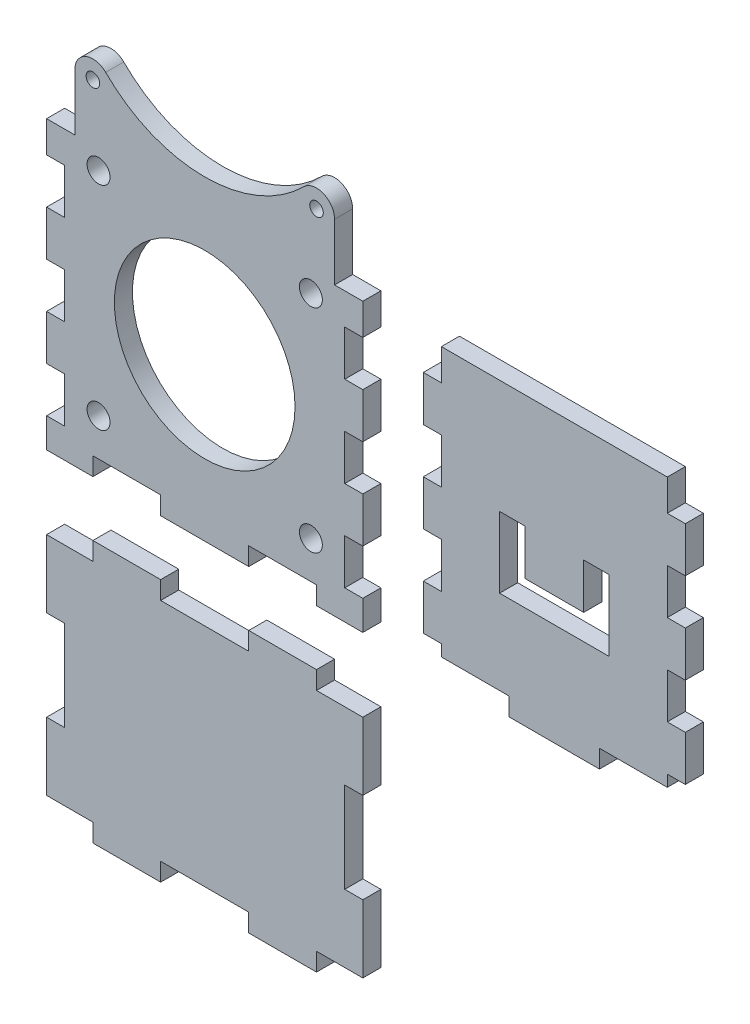
from build123d import *

# Parameters (mm, degrees)
SKETCH1_R             = 2.54
SKETCH1_R_2           = 20
SKETCH1_R_3           = 1.5
BOSS_EXTRUDE1_DEPTH   = 4
BOSS_EXTRUDE1_2_DEPTH = 4
BOSS_EXTRUDE1_3_DEPTH = 4


with BuildPart() as part:
    # Sketch1 → Boss-Extrude1 (new body)
    with BuildSketch(Plane.XY):
        with BuildLine():
            Line((-35, -94.278824944), (-35, -100.830704015))
            Line((-35, -100.830704015), (-24.748737342, -100.830704015))
            Line((-24.748737342, -100.830704015), (-24.748737342, -96.830704015))
            Line((-24.748737342, -96.830704015), (-9.748737342, -96.830704015))
            Line((-9.748737342, -96.830704015), (-9.748737342, -100.830704015))
            Line((-9.748737342, -100.830704015), (9.748737342, -100.830704015))
            Line((9.748737342, -100.830704015), (9.748737342, -96.830704015))
            Line((9.748737342, -96.830704015), (24.748737342, -96.830704015))
            Line((24.748737342, -96.830704015), (24.748737342, -100.830704015))
            Line((24.748737342, -100.830704015), (35, -100.830704015))
            Line((35, -100.830704015), (35, -94.278824944))
            Line((35, -94.278824944), (31, -94.278824944))
            Line((31, -94.278824944), (31, -84.278824944))
            Line((31, -84.278824944), (35, -84.278824944))
            Line((35, -84.278824944), (35, -74.278824944))
            Line((35, -74.278824944), (31, -74.278824944))
            Line((31, -74.278824944), (31, -64.278824944))
            Line((31, -64.278824944), (35, -64.278824944))
            Line((35, -64.278824944), (35, -54.278824944))
            Line((35, -54.278824944), (31, -54.278824944))
            Line((31, -54.278824944), (31, -44.278824944))
            Line((31, -44.278824944), (35, -44.278824944))
            Line((35, -44.278824944), (35, -37.330704015))
            Line((35, -37.330704015), (28.748737342, -37.330704015))
            Line((28.748737342, -37.330704015), (28.748737342, -24.748737342))
            ThreePointArc((28.748737342, -24.748737342), (26.279471071, -21.053219211), (21.920310217, -21.920310217))
            ThreePointArc((21.920310217, -21.920310217), (0, -31), (-21.920310217, -21.920310217))
            ThreePointArc((-21.920310217, -21.920310217), (-26.279471071, -21.053219211), (-28.748737342, -24.748737342))
            Line((-28.748737342, -24.748737342), (-28.748737342, -37.330704015))
            Line((-28.748737342, -37.330704015), (-35, -37.330704015))
            Line((-35, -37.330704015), (-35, -44.278824944))
            Line((-35, -44.278824944), (-31, -44.278824944))
            Line((-31, -44.278824944), (-31, -54.278824944))
            Line((-31, -54.278824944), (-35, -54.278824944))
            Line((-35, -54.278824944), (-35, -64.278824944))
            Line((-35, -64.278824944), (-31, -64.278824944))
            Line((-31, -64.278824944), (-31, -74.278824944))
            Line((-31, -74.278824944), (-35, -74.278824944))
            Line((-35, -74.278824944), (-35, -84.278824944))
            Line((-35, -84.278824944), (-31, -84.278824944))
            Line((-31, -84.278824944), (-31, -94.278824944))
            Line((-31, -94.278824944), (-35, -94.278824944))
        make_face()
        with Locations((-23.5, -88.549683874)):
            Circle(SKETCH1_R, mode=Mode.SUBTRACT)
        with Locations((0, -65.049683874)):
            Circle(SKETCH1_R_2, mode=Mode.SUBTRACT)
        with Locations((23.5, -88.549683874)):
            Circle(SKETCH1_R, mode=Mode.SUBTRACT)
        with Locations((-23.5, -41.549683874)):
            Circle(SKETCH1_R, mode=Mode.SUBTRACT)
        with Locations((-24.748737342, -24.748737342)):
            Circle(SKETCH1_R_3, mode=Mode.SUBTRACT)
        with Locations((23.5, -41.549683874)):
            Circle(SKETCH1_R, mode=Mode.SUBTRACT)
        with Locations((24.748737342, -24.748737342)):
            Circle(SKETCH1_R_3, mode=Mode.SUBTRACT)
    extrude(amount=BOSS_EXTRUDE1_DEPTH)


with BuildPart() as body_2:
    # Sketch1 → Boss-Extrude1 2 (new body)
    with BuildSketch(Plane.XY):
        Polygon((87.392932462, -100.830704015), (87.392932462, -96.830704015), (102.392932462, -96.830704015), (102.392932462, -94.278824944), (106.392932462, -94.278824944), (106.392932462, -84.278824944), (102.392932462, -84.278824944), (102.392932462, -74.278824944), (106.392932462, -74.278824944), (106.392932462, -64.278824944), (102.392932462, -64.278824944), (102.392932462, -54.278824944), (106.392932462, -54.278824944), (106.392932462, -44.278824944), (102.392932462, -44.278824944), (102.392932462, -37.330704015), (52.392932462, -37.330704015), (52.392932462, -44.278824944), (48.392932462, -44.278824944), (48.392932462, -54.278824944), (52.392932462, -54.278824944), (52.392932462, -64.278824944), (48.392932462, -64.278824944), (48.392932462, -74.278824944), (52.392932462, -74.278824944), (52.392932462, -84.278824944), (48.392932462, -84.278824944), (48.392932462, -94.278824944), (52.392932462, -94.278824944), (52.392932462, -96.830704015), (67.392932462, -96.830704015), (67.392932462, -100.830704015), align=None)
        Polygon((65.27265077, -78.159810059), (65.27265077, -62.481717659), (70.893098989, -62.481717659), (70.893098989, -72.53936184), (83.892765935, -72.53936184), (83.892765935, -62.481717659), (89.513214154, -62.481717659), (89.513214154, -78.159810059), align=None, mode=Mode.SUBTRACT)
    extrude(amount=BOSS_EXTRUDE1_2_DEPTH)


with BuildPart() as body_3:
    # Sketch1 → Boss-Extrude1 3 (new body)
    with BuildSketch(Plane.XY):
        Polygon((-24.748737342, -117.070270322), (-35, -117.070270322), (-35, -132.070270322), (-31, -132.070270322), (-31, -152.070270322), (-35, -152.070270322), (-35, -167.070270322), (-24.748737342, -167.070270322), (-24.748737342, -171.070270322), (-9.748737342, -171.070270322), (-9.748737342, -167.070270322), (9.748737342, -167.070270322), (9.748737342, -171.070270322), (24.748737342, -171.070270322), (24.748737342, -167.070270322), (35, -167.070270322), (35, -152.070270322), (31, -152.070270322), (31, -132.070270322), (35, -132.070270322), (35, -117.070270322), (24.748737342, -117.070270322), (24.748737342, -113.070270322), (9.748737342, -113.070270322), (9.748737342, -117.070270322), (-9.748737342, -117.070270322), (-9.748737342, -113.070270322), (-24.748737342, -113.070270322), align=None)
    extrude(amount=BOSS_EXTRUDE1_3_DEPTH)


solid = Compound([part.part, body_2.part, body_3.part])
